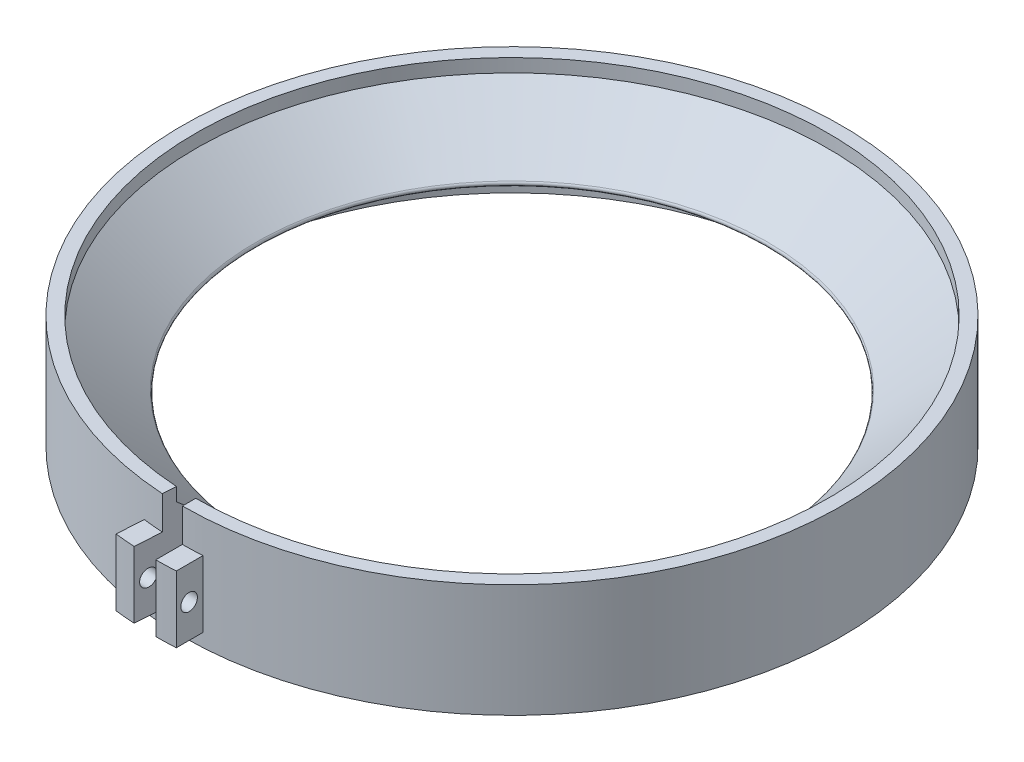
from build123d import *

# Parameters (mm, degrees)
FILLET2_R                       = 0.4
SKETCH5_R                       = 46.656225297
BOSS_EXTRUDE4_DEPTH             = 2
SKETCH6_R                       = 47.53
BOSS_EXTRUDE5_DEPTH             = 2
BOSS_EXTRUDE6_REACH             = 100.932
SKETCH9_R                       = 49.53
BOSS_EXTRUDE6_DIRECTION_2_REACH = 100.932
REVOLVE2_ANGLE                  = 3.6
CUT_EXTRUDE1_DEPTH              = 102.638954604
CUT_EXTRUDE1_DEPTH_BACK         = 102.638954604
BOSS_EXTRUDE7_DEPTH             = 5
CUT_EXTRUDE2_REACH              = 77.663
SKETCH15_R                      = 1.25
CUT_EXTRUDE3_REACH              = 76.528
SKETCH16_R                      = 1.25


with BuildPart() as part:
    # Sketch1 → Revolve1 (revolve)
    with BuildSketch(Plane.XY):
        Polygon((0.662781953, 0), (-8.871246788, 8), (38.658753212, 8), (38.658753212, -5), (-7.997472085, -5), align=None)
    revolve(axis=Axis((38.658753212, 8, 0), (0, -1, 0)))

    # Fillet2
    fillet2_edges = [part.edges().sort_by_distance(p)[0] for p in [
        (76.654724471, 0, 0),
    ]]
    fillet(fillet2_edges, radius=FILLET2_R)

    # Sketch5 → Boss-Extrude4 (add)
    with BuildSketch(Plane.XZ.offset(5)):
        with Locations((38.658753212, 0)):
            Circle(SKETCH5_R)
    extrude(amount=BOSS_EXTRUDE4_DEPTH)

    # Sketch6 → Boss-Extrude5 (add)
    with BuildSketch(Plane(origin=(0, 8, 0), x_dir=(1, 0, 0), z_dir=(0, 1, 0))):
        with Locations((38.658753212, 0)):
            Circle(SKETCH6_R)
    extrude(amount=BOSS_EXTRUDE5_DEPTH)


with BuildPart() as body_2:

    # Boss-Extrude6: up to this face of the body (flat: up to its plane)
    boss_extrude6_end = Plane(part.part.faces().sort_by_distance((38.658753212, 10, 0))[0])
    # Sketch9 → Boss-Extrude6 (new, up to the picked face)
    with BuildSketch(Plane(origin=(0, 0, 0), x_dir=(1, 0, 0), z_dir=(0, 1, 0)), mode=Mode.PRIVATE) as boss_extrude6_sk1:
        with Locations((38.658753212, 0)):
            Circle(SKETCH9_R)
    boss_extrude6_tool1 = split(extrude(boss_extrude6_sk1.sketch, amount=BOSS_EXTRUDE6_REACH, mode=Mode.PRIVATE), bisect_by=boss_extrude6_end, keep=Keep.BOTH, mode=Mode.PRIVATE)
    add(boss_extrude6_tool1.solids().sort_by(Axis((38.658753, 0, 0), (0, 1, 0)))[0])


    # Boss-Extrude6 direction 2: up to this face of the body (flat: up to its plane)
    boss_extrude6_direction_2_end = Plane(part.part.faces().sort_by_distance((38.658753212, -7, 0))[0])
    # Sketch9 → Boss-Extrude6 direction 2 (add, up to the picked face)
    with BuildSketch(Plane(origin=(0, 0, 0), x_dir=(1, 0, 0), z_dir=(0, 1, 0)), mode=Mode.PRIVATE) as boss_extrude6_direction_2_sk1:
        with Locations((38.658753212, 0)):
            Circle(SKETCH9_R)
    boss_extrude6_direction_2_tool1 = split(extrude(boss_extrude6_direction_2_sk1.sketch, amount=-BOSS_EXTRUDE6_DIRECTION_2_REACH, mode=Mode.PRIVATE), bisect_by=boss_extrude6_direction_2_end, keep=Keep.BOTH, mode=Mode.PRIVATE)
    add(boss_extrude6_direction_2_tool1.solids().sort_by(Axis((38.658753, 0, 0), (0, -1, 0)))[0])


with BuildPart() as body_3:
    # Sketch7 → Revolve2 (revolve)
    with BuildSketch(Plane.XY):
        Polygon((0.662781953, 0), (-8.871246788, 8), (38.658753212, 8), (38.658753212, -5), (-7.997472085, -5), align=None)
    revolve(axis=Axis((38.658753212, 8, 0), (0, 1, 0)), revolution_arc=REVOLVE2_ANGLE)


with BuildPart() as body_2_1:
    add(body_2.part)

    # Combine2: cut body 3, part
    add(body_3.part, mode=Mode.SUBTRACT)
    add(part.part, mode=Mode.SUBTRACT)

    # Sketch12 → Cut-Extrude1 (cut, two sides: drawn at the far end of the back side and taken through both)
    with BuildSketch(Plane(origin=(0, 0, 0), x_dir=(1, 0, 0), z_dir=(0, 1, 0)).offset(-CUT_EXTRUDE1_DEPTH_BACK)):
        Polygon((38.658753212, 0), (38.658753212, -55.308258228), (35.110535157, -56.397310982), align=None)
    extrude(amount=CUT_EXTRUDE1_DEPTH + CUT_EXTRUDE1_DEPTH_BACK, mode=Mode.SUBTRACT)

    # Sketch14 → Boss-Extrude7 (add, symmetric)
    with BuildSketch(Plane(origin=(0, 0, 0), x_dir=(1, 0, 0), z_dir=(0, 1, 0))):
        with BuildLine():
            ThreePointArc((38.658753212, -53.53), (40.159342933, -53.508963086), (41.658753212, -53.445868877))
            Line((41.658753212, -53.445868877), (41.658753212, -49.439062491))
            ThreePointArc((41.658753212, -49.439062491), (40.15944219, -49.507260403), (38.658753212, -49.53))
            Line((38.658753212, -49.53), (38.658753212, -53.53))
        make_face()
        with BuildLine():
            Line((35.297576701, -53.424370773), (35.54873878, -49.432263859))
            ThreePointArc((35.54873878, -49.432263859), (34.0524389, -49.315340093), (32.560368608, -49.153134236))
            Line((32.560368608, -49.153134236), (32.308779153, -53.152034105))
            ThreePointArc((32.308779153, -53.152034105), (33.80126897, -53.309152562), (35.297576701, -53.424370773))
        make_face()
    extrude(amount=BOSS_EXTRUDE7_DEPTH, both=True)

    # Sketch15 → Cut-Extrude2 (cut, up to next)
    with BuildSketch(Plane(origin=(41.658753212, 0, 0), x_dir=(0, 0, -1), z_dir=(1, 0, 0)), mode=Mode.PRIVATE) as cut_extrude2_sk1:
        with Locations((-51.523210782, 0)):
            Circle(SKETCH15_R)
    cut_extrude2_tool1 = extrude(cut_extrude2_sk1.sketch, amount=-CUT_EXTRUDE2_REACH, mode=Mode.PRIVATE) & body_2_1.part
    add(cut_extrude2_tool1.solids().sort_by_distance((41.658753, 0, 51.523211))[0], mode=Mode.SUBTRACT)

    # Sketch16 → Cut-Extrude3 (cut, up to next)
    with BuildSketch(Plane(origin=(35.512255119, 0, 2.234241714), x_dir=(-0.0627905195293095, 0, 0.9980267284282719), z_dir=(-0.9980267284282718, 0, -0.06279051952930949)), mode=Mode.PRIVATE) as cut_extrude3_sk1:
        with Locations((49.072528079, 0)):
            Circle(SKETCH16_R)
    cut_extrude3_tool1 = extrude(cut_extrude3_sk1.sketch, amount=-CUT_EXTRUDE3_REACH, mode=Mode.PRIVATE) & body_2_1.part
    add(cut_extrude3_tool1.solids().sort_by_distance((32.430966, 0, 51.209936))[0], mode=Mode.SUBTRACT)


solid = body_2_1.part
